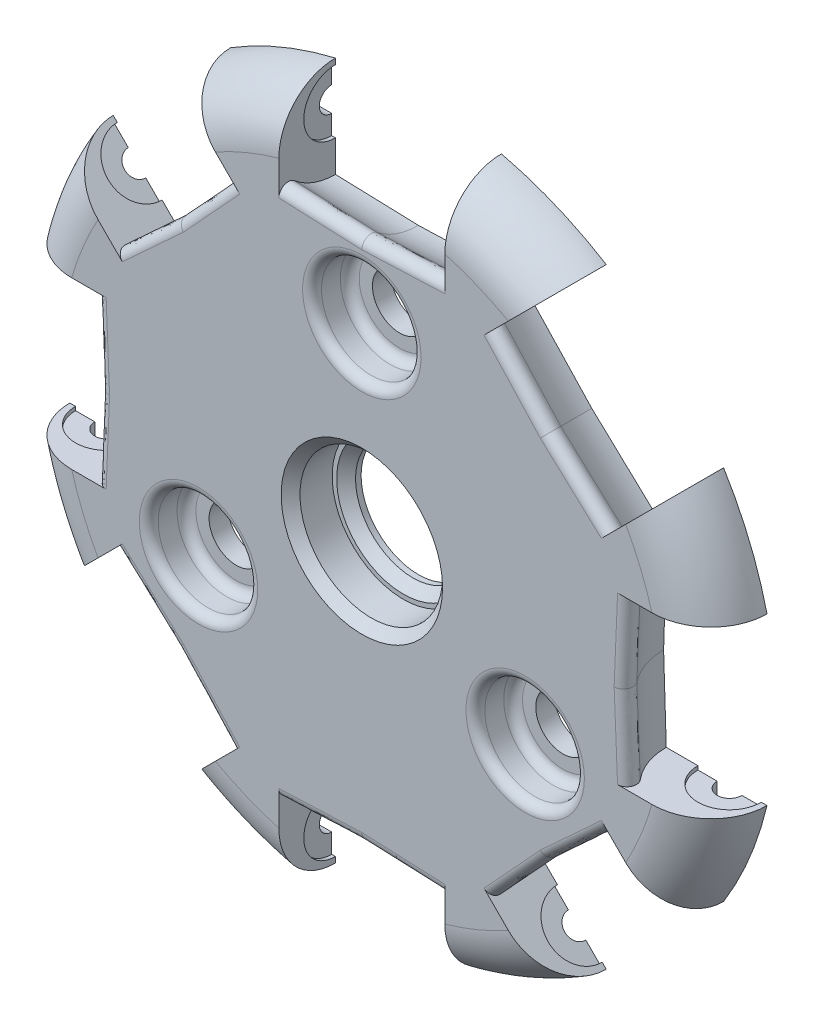
from build123d import *

# Parameters (mm, degrees)
SKETCH1_R                = 30.1625
BOSS_EXTRUDE1_DEPTH      = 4.7625
FILLET1_R                = 4.7625
FILLET2_R                = 0.79375
CIRPATTERN1_COUNT        = 8
FILLET2_OF_CIRPATTERN1_R = 0.79375
SKETCH2_R                = 2.286
CUT_EXTRUDE1_DEPTH       = 42.769052915
SKETCH3_R                = 4.191
CUT_EXTRUDE2_DEPTH       = 3.175
FILLET3_R                = 0.79375
CIRPATTERN2_COUNT        = 3
FILLET3_OF_CIRPATTERN2_R = 0.79375
SKETCH4_R                = 4.826
CUT_EXTRUDE3_DEPTH       = 42.769052915
SKETCH5_R                = 6
CUT_EXTRUDE4_DEPTH       = 3.5
CHAMFER1_SIZE            = 0.79375


# Read off the part's stored shape, not the designer's step: Cavity2
with BuildPart() as part:
    # Sketch1 → Boss-Extrude1 (new body)
    with BuildSketch(Plane.XY):
        with Locations(Location((0, 0, 0), (0, 0, 180))):
            Circle(SKETCH1_R)
    extrude(amount=BOSS_EXTRUDE1_DEPTH)

    # Fillet1
    fillet1_edges = [part.edges().sort_by_distance(p)[0] for p in [
        (30.1625, 0, 4.7625),
    ]]
    fillet(fillet1_edges, radius=FILLET1_R - 0.0001)  # a hair under: the kernel refuses the full size

    # Cavity2 outline → Cavity2 (revolve, cut)
    with BuildSketch(Plane(origin=(0, 26.19375, 0), x_dir=(0, 1, 0), z_dir=(0, 0, -1))):
        Polygon((1.0414, 9.525), (0, 9.525), (0, -9.525), (1.0414, -9.525), (1.0414, -7.3025), (2.667, -7.3025), (2.667, -6.985), (5.334, -6.985), (5.55625, 0), (5.333999999, 6.985000047), (2.667, 6.985), (2.667, 7.3025), (1.0414, 7.3025), align=None)
    cavity2 = revolve(axis=Axis((0, 26.19375, 0), (1, 0, 0)), mode=Mode.SUBTRACT)

    # Fillet2
    fillet2_edges = [part.edges().sort_by_distance(p)[0] for p in [
        (3.493004337, 23.554089934, 4.7625),
        (-3.493004314, 23.554089933, 4.7625),
    ]]
    fillet(fillet2_edges, radius=FILLET2_R)

    # CirPattern1: Cavity2 ×8 about axis
    cirpattern1_axis = Axis((0, 0, 4.7625), (0, 0, 1))
    for i in range(1, CIRPATTERN1_COUNT):
        add(cavity2.rotate(cirpattern1_axis, i * 360 / CIRPATTERN1_COUNT), mode=Mode.SUBTRACT)

    # Fillet2 of CirPattern1
    fillet2_of_cirpattern1_edges = [part.edges().sort_by_distance(p)[0] for p in [
        (-14.185329664, 19.125183771, 4.7625),
        (-19.125183754, 14.18532968, 4.7625),
        (-23.554089934, 3.493004337, 4.7625),
        (-23.554089933, -3.493004314, 4.7625),
        (-19.125183771, -14.185329664, 4.7625),
        (-14.18532968, -19.125183754, 4.7625),
        (-3.493004337, -23.554089934, 4.7625),
        (3.493004314, -23.554089933, 4.7625),
        (14.185329664, -19.125183771, 4.7625),
        (19.125183754, -14.18532968, 4.7625),
        (23.554089934, -3.493004337, 4.7625),
        (23.554089933, 3.493004314, 4.7625),
        (19.125183771, 14.185329664, 4.7625),
        (14.18532968, 19.125183754, 4.7625),
    ]]
    fillet(fillet2_of_cirpattern1_edges, radius=FILLET2_OF_CIRPATTERN1_R)

    # Sketch2 → Cut-Extrude1 (cut, through all)
    with BuildSketch(Plane(origin=(0, 0, 0), x_dir=(-1, 0, 0), z_dir=(0, 0, -1))):
        with Locations((-13.748153285, -7.9375)):
            Circle(SKETCH2_R)
        with Locations((13.748153285, -7.9375)):
            Circle(SKETCH2_R)
        with Locations((0, 15.875)):
            Circle(SKETCH2_R)
    extrude(amount=-CUT_EXTRUDE1_DEPTH, mode=Mode.SUBTRACT)

    # Sketch3 → Cut-Extrude2 (cut)
    with BuildSketch(Plane.XY.offset(4.7625)):
        with Locations((0, 15.875)):
            Circle(SKETCH3_R)
    cut_extrude2 = extrude(amount=-CUT_EXTRUDE2_DEPTH, mode=Mode.SUBTRACT)

    # Fillet3
    fillet3_edges = [part.edges().sort_by_distance(p)[0] for p in [
        (-4.191, 15.875, 4.7625),
        (-4.191, 15.875, 1.5875),
    ]]
    fillet(fillet3_edges, radius=FILLET3_R)

    # CirPattern2: Cut-Extrude2 ×3 about axis
    cirpattern2_axis = Axis((0, 0, 0), (0, 0, 1))
    for i in range(1, CIRPATTERN2_COUNT):
        add(cut_extrude2.rotate(cirpattern2_axis, i * 360 / CIRPATTERN2_COUNT), mode=Mode.SUBTRACT)

    # Fillet3 of CirPattern2
    fillet3_of_cirpattern2_edges = [part.edges().sort_by_distance(p)[0] for p in [
        (-11.652653285, -11.567012467, 4.7625),
        (-11.652653285, -11.567012467, 1.5875),
        (15.843653285, -4.307987533, 4.7625),
        (15.843653285, -4.307987533, 1.5875),
    ]]
    fillet(fillet3_of_cirpattern2_edges, radius=FILLET3_OF_CIRPATTERN2_R)

    # Sketch4 → Cut-Extrude3 (cut, through all)
    with BuildSketch(Plane(origin=(0, 0, 0), x_dir=(-1, 0, 0), z_dir=(0, 0, -1))):
        Circle(SKETCH4_R)
    extrude(amount=-CUT_EXTRUDE3_DEPTH, mode=Mode.SUBTRACT)

    # Sketch5 → Cut-Extrude4 (cut)
    with BuildSketch(Plane.XY.offset(4.7625)):
        Circle(SKETCH5_R)
    extrude(amount=-CUT_EXTRUDE4_DEPTH, mode=Mode.SUBTRACT)

    # Chamfer1
    chamfer1_edges = [part.edges().sort_by_distance(p)[0] for p in [
        (-6, 0, 4.7625),
        (4.826, 0, 1.2625),
    ]]
    chamfer(chamfer1_edges, length=CHAMFER1_SIZE)


solid = part.part
